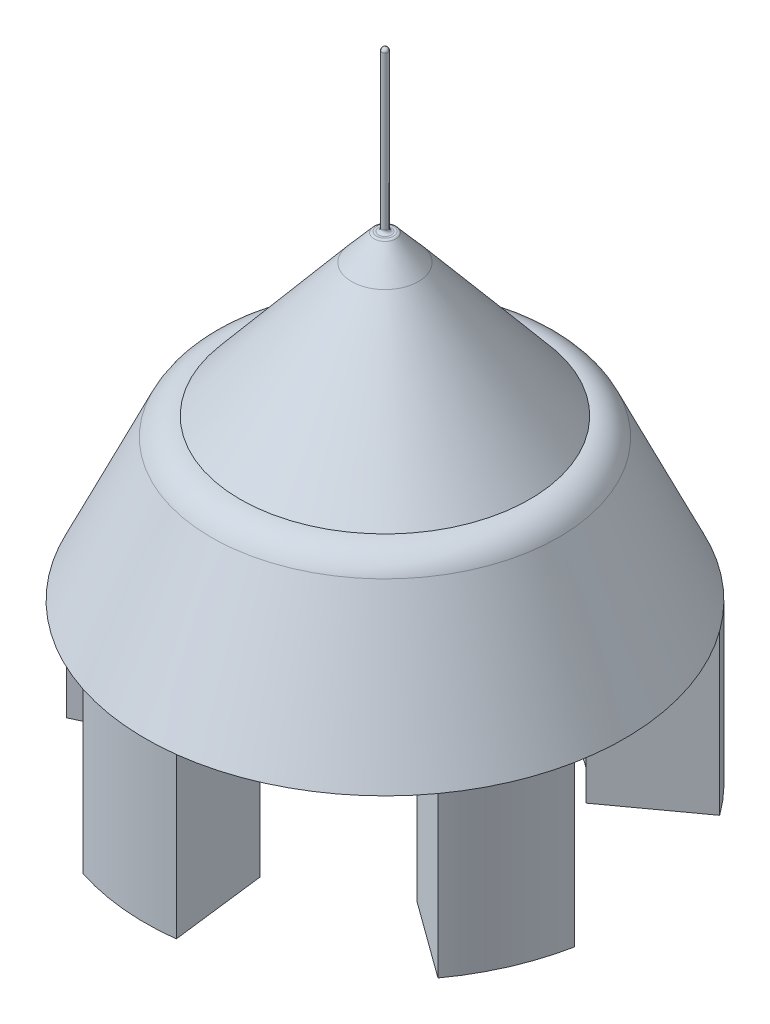
from build123d import *

# Parameters (mm, degrees)
PROFIL_BASE_R                = 75
BASE_DEPTH                   = 50
BASE_TAPER                   = 25
CONG_1_R                     = 10
PIED_DEPTH                   = 50
R_P_TITION_CIRCULAIRE1_COUNT = 5
ESQUISSE3_R                  = 45.313914484
BOSS_EXTRU_3_DEPTH           = 50
BOSS_EXTRU_3_TAPER           = 40
ESQUISSE5_R                  = 1
BOSS_EXTRU_4_DEPTH           = 50
CONG_2_R                     = 1
CHANFREIN1_SIZE              = 0.254371318
CHANFREIN1_SIZE_2            = 11
CONG_3_R                     = 1
CONG_4_R                     = 1


with BuildPart() as part:
    # profil Base → Base (new body)
    with BuildSketch(Plane(origin=(0, 0, 0), x_dir=(1, 0, 0), z_dir=(0, 1, 0))):
        Circle(PROFIL_BASE_R)
    extrude(amount=BASE_DEPTH, taper=BASE_TAPER)

    # Congé1
    cong_1_edges = [part.edges().sort_by_distance(p)[0] for p in [
        (-51.684617092, 50, 0),
    ]]
    fillet(cong_1_edges, radius=CONG_1_R)

    # Profil Pied → Pied (add)
    with BuildSketch(Plane.XZ):
        with BuildLine():
            Line((-75, 0), (-45, 0))
            ThreePointArc((-45, 0), (-43.93332032, 9.739782627), (-40.783850417, 19.017821778))
            Line((-40.783850417, 19.017821778), (-67.973084028, 31.696369631))
            ThreePointArc((-67.973084028, 31.696369631), (-73.222200534, 16.232971045), (-75, 0))
        make_face()
    pied = extrude(amount=PIED_DEPTH)

    # Répétition circulaire1: Pied ×5 about axis
    r_p_tition_circulaire1_axis = Axis((0, 0, 0), (0, 1, 0))
    for i in range(1, R_P_TITION_CIRCULAIRE1_COUNT):
        add(pied.rotate(r_p_tition_circulaire1_axis, i * 360 / R_P_TITION_CIRCULAIRE1_COUNT))

    # Esquisse3 → Boss.-Extru.3 (add)
    with BuildSketch(Plane(origin=(0, 50, 0), x_dir=(1, 0, 0), z_dir=(0, 1, 0))):
        Circle(ESQUISSE3_R)
    extrude(amount=BOSS_EXTRU_3_DEPTH, taper=BOSS_EXTRU_3_TAPER)

    # Esquisse5 → Boss.-Extru.4 (add)
    with BuildSketch(Plane(origin=(0, 100, 0), x_dir=(1, 0, 0), z_dir=(0, 1, 0))):
        with Locations(Location((0, 0, 0), (0, 0, 270))):
            Circle(ESQUISSE5_R)
    extrude(amount=BOSS_EXTRU_4_DEPTH)

    # Congé2
    cong_2_edges = [part.edges().sort_by_distance(p)[0] for p in [
        (0, 150, -1),
    ]]
    fillet(cong_2_edges, radius=CONG_2_R)

    # Chanfrein1
    # the kernel refuses this chamfer: 11, 0.254371318 mm, written as the material it takes off along each edge
    with BuildSketch(Plane(origin=(0, 100, 0), x_dir=(1, 0, 0), z_dir=(0, 0, -1))) as chanfrein1_piece_1:
        Polygon((3.358932925 - CHANFREIN1_SIZE, 0), (3.358932925 + CHANFREIN1_SIZE_2 * 0.642787609687, CHANFREIN1_SIZE_2 * 0.766044443119), (3.358932925, 0), align=None)
    revolve(axis=Axis((0, 100, 0), (0, -1, 0)), mode=Mode.SUBTRACT)

    # Congé3
    cong_3_edges = [part.edges().sort_by_distance(p)[0] for p in [
        (-3.104561607, 100, 0),
    ]]
    fillet(cong_3_edges, radius=CONG_3_R)

    # Congé4
    cong_4_edges = [part.edges().sort_by_distance(p)[0] for p in [
        (0, 100, -1),
    ]]
    fillet(cong_4_edges, radius=CONG_4_R)


solid = part.part
